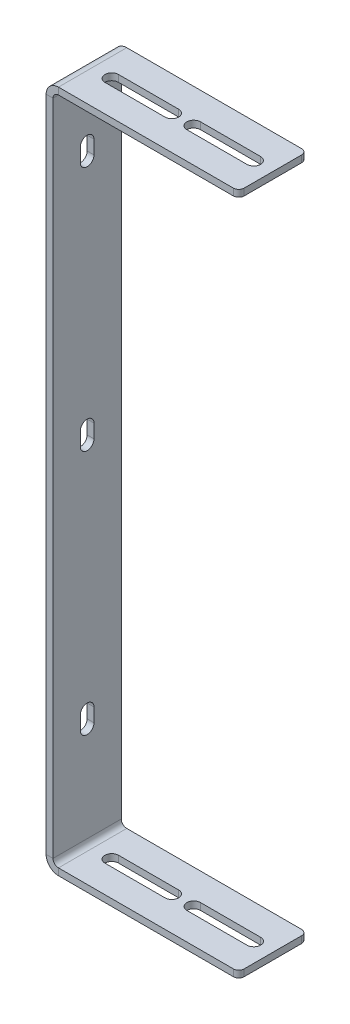
from build123d import *

# Parameters (mm, degrees)
SM_BASE_FLANGE_1_DEPTH = 12.5
CUT_EXTRUDE_1_DEPTH    = 257.975679783
CUT_EXTRUDE_2_DEPTH    = 260.384367301
OTHER_START            = -247.5
OTHER_1_DEPTH          = 250


# Read off the part's stored shape, not the designer's step: 断开-边角1
# Sheet-metal steps are written as plain solids
with BuildPart() as part:
    # Sketch 1 → 基体-法兰1 (new, symmetric)
    with BuildSketch(Plane.XY):
        with BuildLine():
            Line((68, 0), (2, 0))
            ThreePointArc((2, 0), (0.585786438, -0.585786438), (0, -2))
            Line((0, -2), (0, -243))
            ThreePointArc((0, -243), (0.585786438, -244.414213562), (2, -245))
            Line((2, -245), (68, -245))
            Line((68, -245), (68, -247.5))
            Line((68, -247.5), (2, -247.5))
            ThreePointArc((2, -247.5), (-1.181980515, -246.181980515), (-2.5, -243))
            Line((-2.5, -243), (-2.5, -2))
            ThreePointArc((-2.5, -2), (-1.181980515, 1.181980515), (2, 2.5))
            Line((2, 2.5), (68, 2.5))
            Line((68, 2.5), (68, 0))
        make_face()
    extrude(amount=SM_BASE_FLANGE_1_DEPTH, both=True)

    # 草图4 → 切除-拉伸1 (cut, through all)
    with BuildSketch(Plane(origin=(0, 0, 0), x_dir=(0, 0, -1), z_dir=(1, 0, 0))):
        with BuildLine():
            Line((2.5, -22.5), (2.5, -27.5))
            ThreePointArc((2.5, -27.5), (0, -30), (-2.5, -27.5))
            Line((-2.5, -27.5), (-2.5, -22.5))
            ThreePointArc((-2.5, -22.5), (0, -20), (2.5, -22.5))
        make_face()
        with BuildLine():
            Line((2.5, -112.5), (2.5, -117.5))
            ThreePointArc((2.5, -117.5), (0, -120), (-2.5, -117.5))
            Line((-2.5, -117.5), (-2.5, -112.5))
            ThreePointArc((-2.5, -112.5), (0, -110), (2.5, -112.5))
        make_face()
        with BuildLine():
            Line((2.5, -207.5), (2.5, -202.5))
            ThreePointArc((2.5, -202.5), (0, -200), (-2.5, -202.5))
            Line((-2.5, -202.5), (-2.5, -207.5))
            ThreePointArc((-2.5, -207.5), (0, -210), (2.5, -207.5))
        make_face()
    extrude(amount=-CUT_EXTRUDE_1_DEPTH, mode=Mode.SUBTRACT)

    # 草图7 → 切除-拉伸2 (cut, through all)
    with BuildSketch(Plane(origin=(0, 2.5, 0), x_dir=(1, 0, 0), z_dir=(0, 1, 0))):
        with BuildLine():
            Line((39, 2.5), (61, 2.5))
            ThreePointArc((61, 2.5), (63.5, 0), (61, -2.5))
            Line((61, -2.5), (39, -2.5))
            ThreePointArc((39, -2.5), (36.5, 0), (39, 2.5))
        make_face()
        with BuildLine():
            Line((31, 2.5), (9, 2.5))
            ThreePointArc((9, 2.5), (6.5, 0), (9, -2.5))
            Line((9, -2.5), (31, -2.5))
            ThreePointArc((31, -2.5), (33.5, 0), (31, 2.5))
        make_face()
    extrude(amount=-CUT_EXTRUDE_2_DEPTH, mode=Mode.SUBTRACT)

    # Other 1 outline → Other 1 (cut)
    with BuildSketch(Plane(origin=(0, 0, 0), x_dir=(1, 0, 0), z_dir=(0, 1, 0)).offset(OTHER_START)):
        with BuildLine():
            Line((68, -12.5), (68, -10.5))
            ThreePointArc((68, -10.5), (67.414213562, -11.914213562), (66, -12.5))
            Line((66, -12.5), (68, -12.5))
        make_face()
        with BuildLine():
            ThreePointArc((66, 12.5), (67.414213562, 11.914213562), (68, 10.5))
            Line((68, 10.5), (68, 12.5))
            Line((68, 12.5), (66, 12.5))
        make_face()
    extrude(amount=OTHER_1_DEPTH, mode=Mode.SUBTRACT)


solid = part.part
